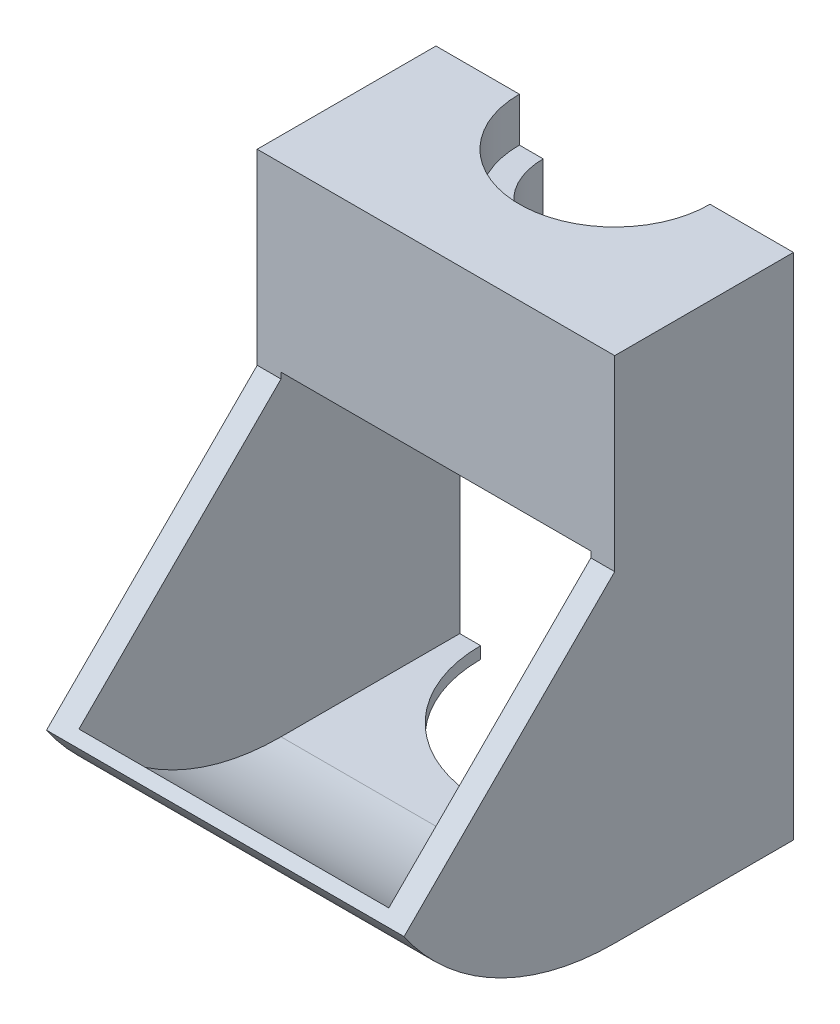
from build123d import *

# Parameters (mm, degrees)
SKETCH2_W           = 30
SKETCH2_H           = 42.7
BOSS_EXTRUDE1_DEPTH = 15
BOSS_EXTRUDE2_DEPTH = 15
CUT_EXTRUDE1_DEPTH  = 13


with BuildPart() as part:
    # Sketch2 → Boss-Extrude1 (new body)
    with BuildSketch(Plane.XY):
        with Locations((0, 21.35)):
            Rectangle(SKETCH2_W, SKETCH2_H)
    extrude(amount=BOSS_EXTRUDE1_DEPTH)

    # Sketch3 → Boss-Extrude2 (add, symmetric)
    with BuildSketch(Plane(origin=(0, 0, 0), x_dir=(0, 0, -1), z_dir=(1, 0, 0))):
        with BuildLine():
            ThreePointArc((-32.67766953, 9.32233047), (-24.992570307, 2.473369414), (-15, 0))
            Line((-15, 0), (-15, 27))
            Line((-15, 27), (-32.67766953, 9.32233047))
        make_face()
    extrude(amount=BOSS_EXTRUDE2_DEPTH, both=True)

    # Sketch4 → Cut-Revolve1 (revolve, cut)
    with BuildSketch(Plane(origin=(0, 0, 0), x_dir=(-1, 0, 0), z_dir=(0, 0, -1))):
        Polygon((0, 42.7), (8, 42.7), (8, 39), (6, 39), (6, 33), (8, 33), (8, 27.5), (11.25, 27.5), (11.25, 0), (0, 0), align=None)
    revolve(axis=Axis((0, 51.479366375, 0), (0, -1, 0)), mode=Mode.SUBTRACT)

    # Sketch5 → Cut-Extrude1 (cut, symmetric)
    with BuildSketch(Plane(origin=(0, 0, 0), x_dir=(0, 0, -1), z_dir=(1, 0, 0))):
        with BuildLine():
            Line((-31.95764431, 10.04235569), (-15.707106781, 26.292893219))
            Line((-15.707106781, 26.292893219), (-16.914213562, 27.5))
            Line((-16.914213562, 27.5), (-11.25, 27.5))
            Line((-11.25, 27.5), (0, 27.5))
            Line((0, 27.5), (0, 1))
            Line((0, 1), (-15, 1))
            ThreePointArc((-15, 1), (-24.6089268, 3.40182828), (-31.95764431, 10.04235569))
        make_face()
    extrude(amount=CUT_EXTRUDE1_DEPTH, both=True, mode=Mode.SUBTRACT)


solid = part.part
